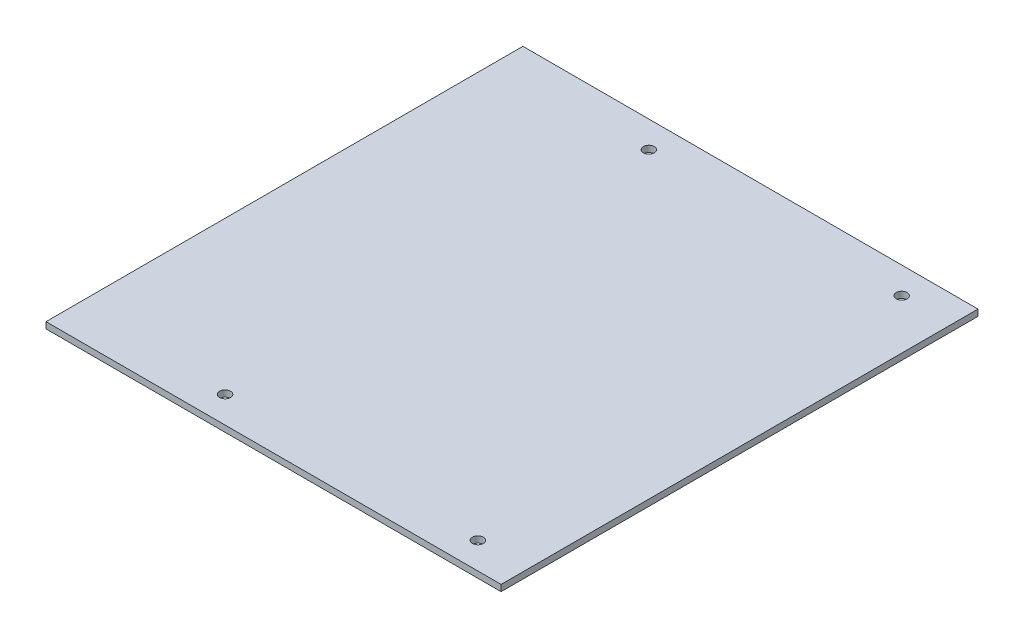
from build123d import *

# Parameters (mm, degrees)
SKETCH1_W            = 228.6
SKETCH1_H            = 239.55
BOSS_EXTRUDE1_DEPTH  = 1.5875
M5_CLEARANCE_HOLE1_D = 5.5


with BuildPart() as part:
    # Sketch1 → Boss-Extrude1 (new, symmetric)
    with BuildSketch(Plane(origin=(0, 0, 0), x_dir=(1, 0, 0), z_dir=(0, 1, 0))):
        with Locations((-254.65, 0)):
            Rectangle(SKETCH1_W, SKETCH1_H)
    extrude(amount=BOSS_EXTRUDE1_DEPTH, both=True)

    # M5 Clearance Hole1 (through all)
    with Locations(Plane(origin=(0, 1.5875, 0), x_dir=(1, 0, 0), z_dir=(0, 1, 0))):
        with Locations((-292.35, 106.425), (-165.35, 106.425), (-165.35, -106.425), (-292.35, -106.425)):
            Hole(M5_CLEARANCE_HOLE1_D / 2)


solid = part.part
